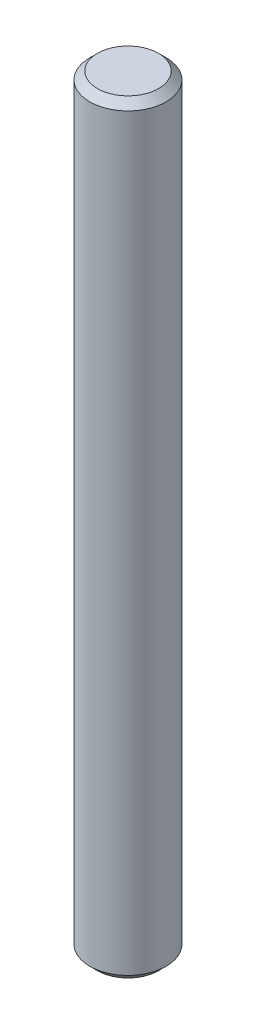
from build123d import *

# Parameters (mm, degrees)
SKETCH1_R           = 2.5
BOSS_EXTRUDE1_DEPTH = 50
CHAMFER1_SIZE       = 0.5


with BuildPart() as part:
    # Sketch1 → Boss-Extrude1 (new body)
    with BuildSketch(Plane(origin=(0, 0, 0), x_dir=(1, 0, 0), z_dir=(0, 1, 0))):
        Circle(SKETCH1_R)
    extrude(amount=BOSS_EXTRUDE1_DEPTH)

    # Chamfer1
    chamfer1_edges = [part.edges().sort_by_distance(p)[0] for p in [
        (-2.5, 50, 0),
        (-2.5, 0, 0),
    ]]
    chamfer(chamfer1_edges, length=CHAMFER1_SIZE)


solid = part.part
